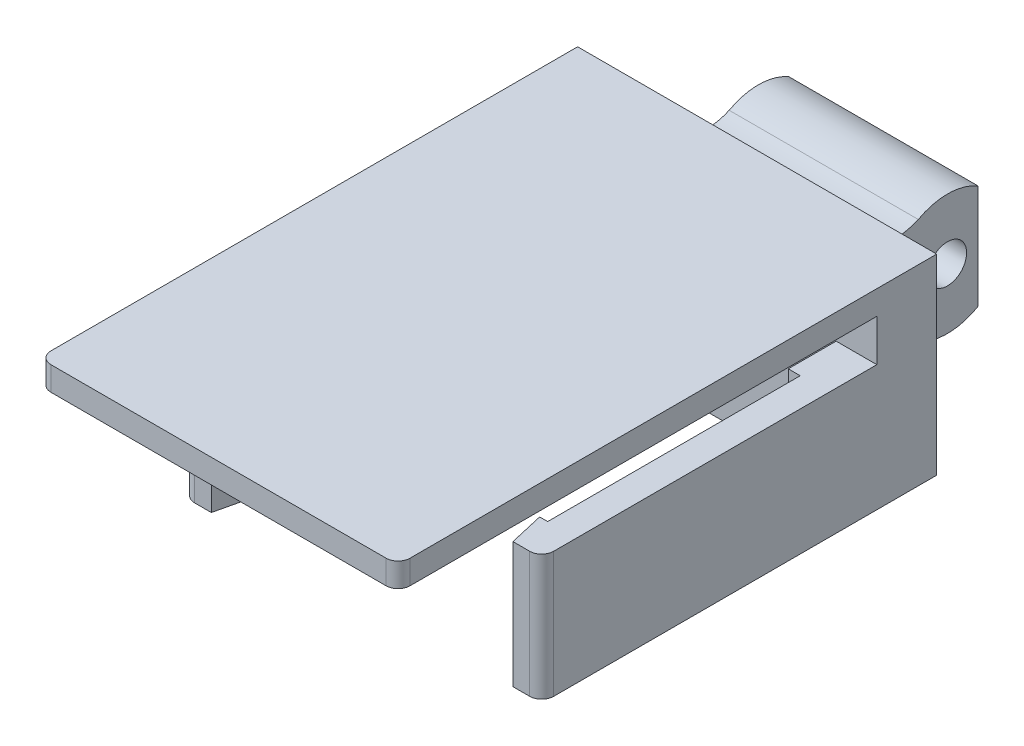
from build123d import *

# Parameters (mm, degrees)
CROQUIS2_R                   = 1.6
SALIENTE_EXTRUIR1_DEPTH      = 15
CORTAR_EXTRUIR1_REACH        = 52.06
REDONDEO1_R                  = 1
CORTAR_EXTRUIR_L_MINA1_DEPTH = 16


# Read off the part's stored shape, not the designer's step: Cortar-Extruir-Lámina1
with BuildPart() as part:
    # Croquis2 → Saliente-Extruir1 (new, symmetric)
    with BuildSketch(Plane(origin=(0, 0, 0), x_dir=(0, 0, -1), z_dir=(1, 0, 0))):
        with BuildLine():
            Line((0, 16), (-45, 16))
            Line((-45, 16), (-45, 14))
            Line((-45, 14), (-5, 14))
            Line((-5, 14), (-5, 10.5))
            Line((-5, 10.5), (-33, 10.5))
            Line((-33, 10.5), (-33, 0))
            Line((-33, 0), (0, 0))
            Line((0, 0), (2, 2))
            Line((2, 2), (2, 2.75))
            Line((2, 2.75), (3, 3.75))
            Line((3, 3.75), (3.55, 3.75))
            ThreePointArc((3.55, 3.75), (4.578743846, 3.643024228), (5.563467425, 3.32667444))
            ThreePointArc((5.563467425, 3.32667444), (8.065241178, 2.700421444), (10.55, 3.391101056))
            Line((10.55, 3.391101056), (10.55, 12.108898944))
            ThreePointArc((10.55, 12.108898944), (8.065241178, 12.799578556), (5.563467425, 12.17332556))
            ThreePointArc((5.563467425, 12.17332556), (4.578743846, 11.856975772), (3.55, 11.75))
            Line((3.55, 11.75), (3, 11.75))
            Line((3, 11.75), (2, 12.75))
            Line((2, 12.75), (2, 14))
            Line((2, 14), (0, 16))
        make_face()
        with Locations((8, 7.75)):
            Circle(CROQUIS2_R, mode=Mode.SUBTRACT)
    extrude(amount=SALIENTE_EXTRUIR1_DEPTH, both=True)

    # Croquis3 → Cortar-Extruir1 (cut, up to next)
    with BuildSketch(Plane(origin=(0, 0, 0), x_dir=(1, 0, 0), z_dir=(0, 1, 0)), mode=Mode.PRIVATE) as cortar_extruir1_sk1:
        Polygon((11.6, -5), (-11.6, -5), (-11.6, -9), (-12.6, -9), (-12.6, -30.1), (-11.93, -30.1), (-12.6, -33), (12.6, -33), (11.93, -30.1), (12.6, -30.1), (12.6, -9), (11.6, -9), align=None)
    cortar_extruir1_tool1 = extrude(cortar_extruir1_sk1.sketch, amount=CORTAR_EXTRUIR1_REACH, mode=Mode.PRIVATE) & part.part
    add(cortar_extruir1_tool1.solids().sort_by_distance((0, 0, 19.104296))[0], mode=Mode.SUBTRACT)

    # Redondeo1
    redondeo1_edges = [part.edges().sort_by_distance(p)[0] for p in [
        (-15, 5.25, 33),
        (-15, 15, 45),
        (15, 15, 45),
        (15, 5.25, 33),
    ]]
    fillet(redondeo1_edges, radius=REDONDEO1_R)

    # Cortar-Extruir-Lámina1 outline → Cortar-Extruir-Lámina1 (cut)
    with BuildSketch(Plane(origin=(0, 0, 0), x_dir=(1, 0, 0), z_dir=(0, 1, 0))):
        Polygon((-15, 0), (-13, 2), (-8.9, 2), (-7.9, 3), (-7.9, 10.55), (-15, 10.55), align=None)
        Polygon((7.9, 3), (8.9, 2), (13, 2), (15, 0), (15, 10.55), (7.9, 10.55), align=None)
    extrude(amount=CORTAR_EXTRUIR_L_MINA1_DEPTH, mode=Mode.SUBTRACT)


solid = part.part
